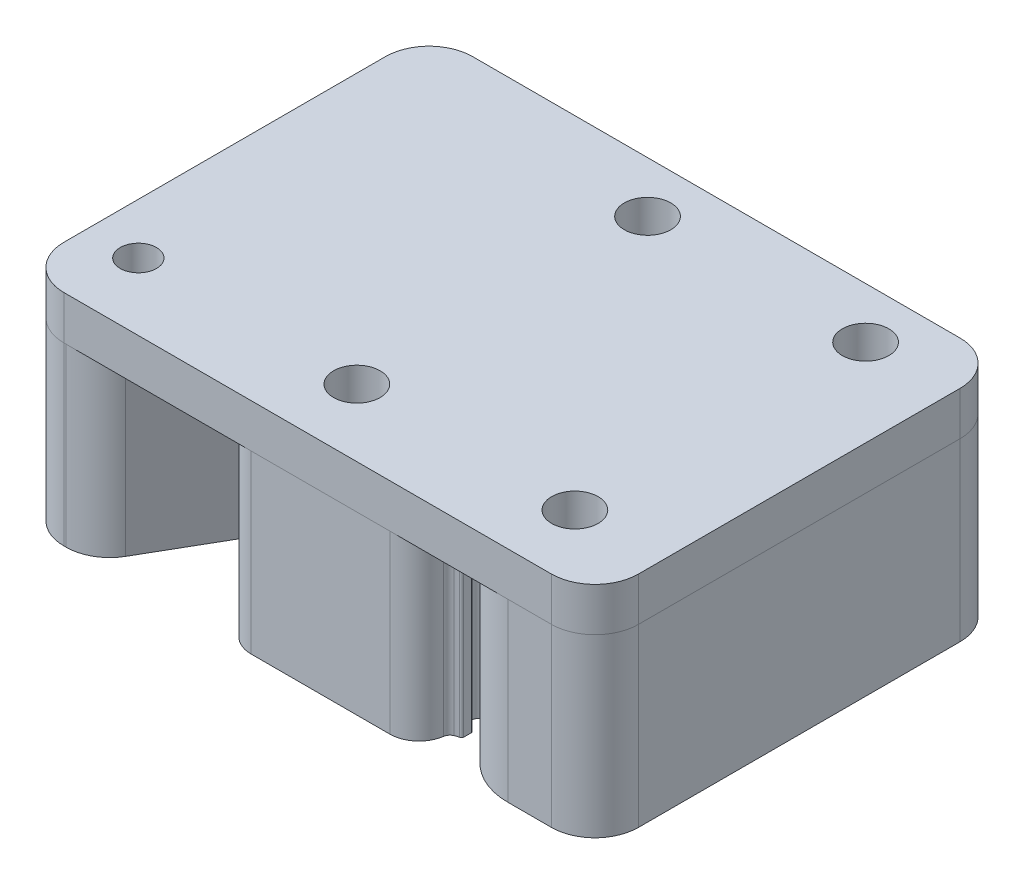
from build123d import *

# Parameters (mm, degrees)
BOSS_EXTRUDE1_DEPTH            = 6.05
M3_CLEARANCE_HOLE1_D           = 3.2
SKETCH6_W                      = 14.5
SKETCH6_H                      = 28.119
BOSS_EXTRUDE3_DEPTH            = 12.1
CUT_EXTRUDE2_DEPTH             = 12.1
SKETCH9_W                      = 3.425
SKETCH9_H                      = 12
CUT_EXTRUDE3_DEPTH             = 12.1
BOSS_EXTRUDE4_DEPTH            = 12.1
LPATTERN1_COUNT                = 9
LPATTERN1_PITCH                = 2
SKETCH12_R                     = 0.5
CUT_EXTRUDE5_DEPTH             = 12.1
CUT_EXTRUDE6_DEPTH             = 12.1
FILLET3_R                      = 0.5
CUT_EXTRUDE7_DEPTH             = 12.1
CUT_EXTRUDE8_DEPTH             = 12.1
M3_CLEARANCE_HOLE2_D           = 3.2
FILLET4_R                      = 3
CUT_EXTRUDE9_DEPTH             = 12.1
SKETCH22_R                     = 0.5
CUT_EXTRUDE10_DEPTH            = 12.1
FILLET5_R                      = 0.5
CBORE_FOR_M3_SHCS1_D           = 3.2
CBORE_FOR_M3_SHCS1_CBORE_D     = 6.5
CBORE_FOR_M3_SHCS1_CBORE_DEPTH = 6
BOSS_EXTRUDE8_DEPTH            = 12.1
FILLET6_R                      = 1
SKETCH31_W                     = 9.119
SKETCH31_H                     = 13.8
CUT_EXTRUDE11_DEPTH            = 12.1
CUT_EXTRUDE12_DEPTH            = 12.1
CUT_EXTRUDE14_DEPTH            = 12.1
CUT_EXTRUDE15_DEPTH            = 12.1
FILLET7_R                      = 2
FILLET8_R                      = 1
CUT_EXTRUDE16_START            = -12.1
CUT_EXTRUDE16_DEPTH            = 12.1
CUT_EXTRUDE17_DEPTH            = 12.1
FILLET9_R                      = 2
BOSS_EXTRUDE9_DEPTH            = 12.1
FILLET10_R                     = 2
SKETCH39_R                     = 1.6
BOSS_EXTRUDE10_DEPTH           = 6
BOSS_EXTRUDE11_DEPTH           = 12.1
SKETCH41_R                     = 1.6
SKETCH41_R_2                   = 1.25
BOSS_EXTRUDE12_DEPTH           = 3


with BuildPart() as part:
    # Sketch1 → Boss-Extrude1 (new, symmetric)
    with BuildSketch(Plane(origin=(0, 0, 0), x_dir=(1, 0, 0), z_dir=(0, 1, 0))):
        Polygon((-13.5, -13.5), (-13.5, -14.619), (13.5, -14.619), (13.5, -13.5), (13.5, 13.5), (-13.5, 13.5), align=None)
    extrude(amount=BOSS_EXTRUDE1_DEPTH, both=True)

    # M3 Clearance Hole1 (through all)
    with Locations(Plane(origin=(0, 6.05, 0), x_dir=(1, 0, 0), z_dir=(0, 1, 0))):
        with Locations((-7.5, 10), (7.5, 10), (7.5, -10), (-7.5, -10)):
            Hole(M3_CLEARANCE_HOLE1_D / 2)

    # Sketch6 → Boss-Extrude3 (add)
    with BuildSketch(Plane(origin=(0, 6.05, 0), x_dir=(1, 0, 0), z_dir=(0, 1, 0))):
        with Locations((-20.75, -0.5595)):
            Rectangle(SKETCH6_W, SKETCH6_H)
    extrude(amount=-BOSS_EXTRUDE3_DEPTH)

    # Sketch8 → Cut-Extrude2 (cut)
    with BuildSketch(Plane(origin=(0, 6.05, 0), x_dir=(1, 0, 0), z_dir=(0, 1, 0))):
        with BuildLine():
            Line((2.881, -10), (2.881, 4))
            Line((2.881, 4), (1.361, 4))
            Line((1.361, 4), (1.361, -14.619))
            Line((1.361, -14.619), (7.5, -14.619))
            ThreePointArc((7.5, -14.619), (4.233873778, -13.266126222), (2.881, -10))
        make_face()
    extrude(amount=-CUT_EXTRUDE2_DEPTH, mode=Mode.SUBTRACT)

    # Sketch9 → Cut-Extrude3 (cut)
    with BuildSketch(Plane(origin=(0, 6.05, 0), x_dir=(1, 0, 0), z_dir=(0, 1, 0))):
        with Locations((4.5935, -2)):
            Rectangle(SKETCH9_W, SKETCH9_H)
    extrude(amount=-CUT_EXTRUDE3_DEPTH, mode=Mode.SUBTRACT)

    # Sketch11 → Boss-Extrude4 (add)
    with BuildSketch(Plane(origin=(0, 6.05, 0), x_dir=(1, 0, 0), z_dir=(0, 1, 0))):
        with BuildLine():
            Line((1.361, 4), (1.361, 2.999999996))
            ThreePointArc((1.361, 2.999999996), (1.44536094, 3.29414941), (1.672797753, 3.498876404))
            ThreePointArc((1.672797753, 3.498876404), (1.822937846, 3.557611714), (1.980565217, 3.591456891))
            ThreePointArc((1.980565217, 3.591456891), (2.073771412, 3.641268354), (2.111, 3.740175425))
            Line((2.111, 3.740175425), (2.111, 4))
            Line((2.111, 4), (1.361, 4))
        make_face()
        with BuildLine():
            Line((2.111, 2), (2.111, 2.259824575))
            ThreePointArc((2.111, 2.259824575), (2.073771412, 2.358731646), (1.980565217, 2.408543109))
            ThreePointArc((1.980565217, 2.408543109), (1.822937846, 2.442388286), (1.672797753, 2.501123596))
            ThreePointArc((1.672797753, 2.501123596), (1.445360942, 2.705850587), (1.361, 2.999999996))
            Line((1.361, 2.999999996), (1.361, 2))
            Line((1.361, 2), (2.111, 2))
        make_face()
    boss_extrude4 = extrude(amount=-BOSS_EXTRUDE4_DEPTH)

    # LPattern1: Boss-Extrude4 ×9
    with Locations(*[(0, 0, i * LPATTERN1_PITCH) for i in range(1, LPATTERN1_COUNT)]):
        add(boss_extrude4)

    # Sketch12 → Cut-Extrude5 (cut)
    with BuildSketch(Plane(origin=(0, 6.05, 0), x_dir=(1, 0, 0), z_dir=(0, 1, 0))):
        with Locations((2.111, 4)):
            Circle(SKETCH12_R)
        with Locations((6.306, 4)):
            Circle(SKETCH12_R)
        with Locations((6.306, -8)):
            Circle(SKETCH12_R)
    extrude(amount=-CUT_EXTRUDE5_DEPTH, mode=Mode.SUBTRACT)

    # Sketch13 → Cut-Extrude6 (cut)
    with BuildSketch(Plane(origin=(0, 6.05, 0), x_dir=(1, 0, 0), z_dir=(0, 1, 0))):
        with BuildLine():
            Line((2.111, -14), (1.361, -14))
            Line((1.361, -14), (1.361, -13))
            ThreePointArc((1.361, -13), (1.445360941, -13.294149412), (1.672797753, -13.498876404))
            ThreePointArc((1.672797753, -13.498876404), (1.822937846, -13.557611714), (1.980565217, -13.591456891))
            ThreePointArc((1.980565217, -13.591456891), (2.073771412, -13.641268354), (2.111, -13.740175425))
            Line((2.111, -13.740175425), (2.111, -14))
        make_face()
    extrude(amount=-CUT_EXTRUDE6_DEPTH, mode=Mode.SUBTRACT)

    # Fillet3
    fillet3_edges = [part.edges().sort_by_distance(p)[0] for p in [
        (5.806, 0, 8),
        (6.306, 0, 7.5),
        (5.806, 0, -4),
        (6.306, 0, -3.5),
        (2.611, 0, -4),
        (1.859499402, 0, -3.567857143),
        (2.881, 0, 8),
    ]]
    fillet(fillet3_edges, radius=FILLET3_R)

    # Sketch17 → Cut-Extrude7 (cut)
    with BuildSketch(Plane(origin=(0, 6.05, 0), x_dir=(1, 0, 0), z_dir=(0, 1, 0))):
        Polygon((-21.159530019, -14.619), (-15.513044386, -17.879), (-2.937822174, 3.901923789), (-8.584307806, 7.161923789), align=None)
    extrude(amount=-CUT_EXTRUDE7_DEPTH, mode=Mode.SUBTRACT)

    # Sketch18 → Cut-Extrude8 (cut)
    with BuildSketch(Plane(origin=(0, 6.05, 0), x_dir=(1, 0, 0), z_dir=(0, 1, 0))):
        with BuildLine():
            Line((-28, -14.619), (-26.03420101, -14.619))
            Line((-26.03420101, -14.619), (-26.03420101, -10.212177826))
            Line((-26.03420101, -10.212177826), (-26.03420101, -10))
            ThreePointArc((-26.03420101, -10), (-25.513488055, -8.163196063), (-24.106287465, -6.872933615))
            Line((-24.106287465, -6.872933615), (-14.148521025, 10.374423789))
            Line((-14.148521025, 10.374423789), (-12.343968759, 13.5))
            Line((-12.343968759, 13.5), (-28, 13.5))
            Line((-28, 13.5), (-28, -14.619))
        make_face()
    extrude(amount=-CUT_EXTRUDE8_DEPTH, mode=Mode.SUBTRACT)

    # M3 Clearance Hole2 (through all)
    with Locations(Plane(origin=(0, 6.05, 0), x_dir=(1, 0, 0), z_dir=(0, 1, 0))):
        with Locations((-22.53420101, -10)):
            Hole(M3_CLEARANCE_HOLE2_D / 2)

    # Fillet4
    fillet4_edges = [part.edges().sort_by_distance(p)[0] for p in [
        (13.5, 0, -13.5),
        (13.5, 0, 14.619),
        (-21.159530019, 0, 14.619),
        (-12.343968759, 0, -13.5),
        (-26.03420101, 0, 14.619),
    ]]
    fillet(fillet4_edges, radius=FILLET4_R)

    # Sketch21 → Cut-Extrude9 (cut)
    with BuildSketch(Plane(origin=(0, 6.05, 0), x_dir=(1, 0, 0), z_dir=(0, 1, 0))):
        Polygon((-17.834307806, -8.859546181), (-20.800444814, -7.147046181), (-12.300444814, 7.575385683), (-9.334307806, 5.862885683), align=None)
    extrude(amount=-CUT_EXTRUDE9_DEPTH, mode=Mode.SUBTRACT)

    # Sketch22 → Cut-Extrude10 (cut)
    with BuildSketch(Plane(origin=(0, 6.05, 0), x_dir=(1, 0, 0), z_dir=(0, 1, 0))):
        with Locations((-20.800444814, -7.147046181)):
            Circle(SKETCH22_R)
        with Locations((-12.300444814, 7.575385683)):
            Circle(SKETCH22_R)
        with Locations((-8.584307806, 7.161923789)):
            Circle(SKETCH22_R)
        with Locations((-2.937822174, 3.901923789)):
            Circle(SKETCH22_R)
    extrude(amount=-CUT_EXTRUDE10_DEPTH, mode=Mode.SUBTRACT)

    # Fillet5
    fillet5_edges = [part.edges().sort_by_distance(p)[0] for p in [
        (-9.334307806, 0, -5.862885683),
        (-17.834307806, 0, 8.859546181),
        (-11.867432112, 0, -7.325385683),
        (-20.550444814, 0, 6.714033479),
        (-3.370834875, 0, -4.151923789),
        (-8.151295104, 0, -6.911923789),
        (-20.367432112, 0, 7.397046181),
        (-12.550444814, 0, -7.142372981),
        (-8.834307806, 0, -6.728911087),
        (-3.187822174, 0, -3.468911087),
    ]]
    fillet(fillet5_edges, radius=FILLET5_R)

    # CBORE for M3 SHCS1 (through all)
    with Locations(Plane(origin=(6.955127019, 0, -12.04663337), x_dir=(-0.8660254037844397, 0, -0.4999999999999981), z_dir=(0.4999999999999981, 0, -0.8660254037844397))):
        with Locations((6.995190528, 0)):
            CounterBoreHole(CBORE_FOR_M3_SHCS1_D / 2, CBORE_FOR_M3_SHCS1_CBORE_D / 2, CBORE_FOR_M3_SHCS1_CBORE_DEPTH)

    # Sketch30 → Boss-Extrude8 (add)
    with BuildSketch(Plane(origin=(0, 6.05, 0), x_dir=(1, 0, 0), z_dir=(0, 1, 0))):
        with BuildLine():
            Line((3.381, -8), (5.439974596, -8))
            ThreePointArc((5.439974596, -8), (5.689974596, -8.066987298), (5.872987298, -8.25))
            ThreePointArc((5.872987298, -8.25), (6.659553391, -8.353553391), (6.556, -7.566987298))
            ThreePointArc((6.556, -7.566987298), (6.372987298, -7.383974596), (6.306, -7.133974596))
            Line((6.306, -7.133974596), (6.306, 3.133974596))
            ThreePointArc((6.306, 3.133974596), (6.372987298, 3.383974596), (6.556, 3.566987298))
            ThreePointArc((6.556, 3.566987298), (6.659553391, 4.353553391), (5.872987298, 4.25))
            ThreePointArc((5.872987298, 4.25), (5.689974596, 4.066987298), (5.439974596, 4))
            Line((5.439974596, 4), (2.977025404, 4))
            ThreePointArc((2.977025404, 4), (2.928787691, 4.002332317), (2.881, 4.009307508))
            Line((2.881, 4.009307508), (2.881, -8.5))
            ThreePointArc((2.881, -8.5), (3.027446609, -8.146446609), (3.381, -8))
        make_face()
        with BuildLine():
            Line((-18.084307806, -9.292558883), (-9.084307806, 6.295898385))
            ThreePointArc((-9.084307806, 6.295898385), (-9.387910986, 6.062935472), (-9.767320508, 6.112885683))
            Line((-9.767320508, 6.112885683), (-11.550444814, 7.142372981))
            ThreePointArc((-11.550444814, 7.142372981), (-11.733457516, 7.325385683), (-11.800444814, 7.575385683))
            ThreePointArc((-11.800444814, 7.575385683), (-12.429854337, 8.058348596), (-12.733457516, 7.325385683))
            ThreePointArc((-12.733457516, 7.325385683), (-12.666470218, 7.075385683), (-12.733457516, 6.825385683))
            Line((-12.733457516, 6.825385683), (-20.367432112, -6.397046181))
            ThreePointArc((-20.367432112, -6.397046181), (-20.550444814, -6.580058883), (-20.800444814, -6.647046181))
            ThreePointArc((-20.800444814, -6.647046181), (-21.283407727, -7.276455704), (-20.550444814, -7.580058883))
            ThreePointArc((-20.550444814, -7.580058883), (-20.300444814, -7.513071585), (-20.050444814, -7.580058883))
            Line((-20.050444814, -7.580058883), (-18.267320508, -8.609546181))
            ThreePointArc((-18.267320508, -8.609546181), (-18.034357595, -8.913149361), (-18.084307806, -9.292558883))
        make_face()
    extrude(amount=-BOSS_EXTRUDE8_DEPTH)

    # Fillet6
    fillet6_edges = [part.edges().sort_by_distance(p)[0] for p in [
        (2.881, 0, -4.009307508),
    ]]
    fillet(fillet6_edges, radius=FILLET6_R)

    # Sketch31 → Cut-Extrude11 (cut)
    with BuildSketch(Plane(origin=(0, 6.05, 0), x_dir=(1, 0, 0), z_dir=(0, 1, 0))):
        with Locations((8.9405, 0)):
            Rectangle(SKETCH31_W, SKETCH31_H)
    extrude(amount=-CUT_EXTRUDE11_DEPTH, mode=Mode.SUBTRACT)

    # Sketch32 → Cut-Extrude12 (cut)
    with BuildSketch(Plane(origin=(0, 6.05, 0), x_dir=(1, 0, 0), z_dir=(0, 1, 0))):
        with BuildLine():
            Line((-10.057382948, 7.610482799), (-19.36600954, -8.512531407))
            ThreePointArc((-19.36600954, -8.512531407), (-21.390103971, -6.69227541), (-24.106287465, -6.872933615))
            Line((-24.106287465, -6.872933615), (-13.209994162, 12))
            ThreePointArc((-13.209994162, 12), (-12.111917951, 13.098076211), (-10.611917951, 13.5))
            Line((-10.611917951, 13.5), (-7.5, 13.5))
            ThreePointArc((-7.5, 13.5), (-10.710397966, 11.394039059), (-10.057382948, 7.610482799))
        make_face()
    extrude(amount=-CUT_EXTRUDE12_DEPTH, mode=Mode.SUBTRACT)

    # Sketch34 → Cut-Extrude14 (cut)
    with BuildSketch(Plane.XZ.offset(6.05)):
        with BuildLine():
            Line((0.111, -6.182638696), (-7.442572109, 6.900531975))
            ThreePointArc((-7.442572109, 6.900531975), (-4.514806986, 9.164163493), (-5.841434656, 12.619))
            Line((-5.841434656, 12.619), (0.111, 12.619))
            Line((0.111, 12.619), (0.111, -6.182638696))
        make_face()
    extrude(amount=-CUT_EXTRUDE14_DEPTH, mode=Mode.SUBTRACT)

    # Sketch35 → Cut-Extrude15 (cut)
    with BuildSketch(Plane.XZ.offset(6.05)):
        with BuildLine():
            Line((-7.562177826, -13.5), (1.271281292, -8.4))
            Line((1.271281292, -8.4), (4.387123517, -8.4))
            ThreePointArc((4.387123517, -8.4), (4.512526151, -11.823458253), (7.5, -13.5))
            Line((7.5, -13.5), (-7.562177826, -13.5))
        make_face()
    extrude(amount=-CUT_EXTRUDE15_DEPTH, mode=Mode.SUBTRACT)

    # Fillet7
    # the kernel refuses this fillet: 2 mm, written as the material it adds along each edge
    with BuildSketch(Plane(origin=(4.381, 6.05, 6.9), x_dir=(0, 0, -1), z_dir=(0, -1, 0)), Plane(origin=(4.381, 6.05, -6.9), x_dir=(1, 0, 0), z_dir=(0, -1, 0))) as fillet7_piece_1:
        with BuildLine():
            CenterArc((FILLET7_R, FILLET7_R), FILLET7_R, 180, 90)
            Line((0, FILLET7_R), (0, 0))
            Line((0, 0), (FILLET7_R, 0))
        make_face()
    extrude(amount=12.1)
    with BuildSketch(Plane(origin=(-19.36600954, 6.05, 8.512531407), x_dir=(-0.676555335511721, 0, -0.7363917965258864), z_dir=(0, -1, 0))) as fillet7_piece_2:
        with BuildLine():
            CenterArc((2.695107017, 1.908220012), FILLET7_R, 162.57504771, 90)
            Line((0.786887005, 2.507132682), (0, 0))
            ThreePointArc((0, 0), (1.048097173, 0.160614979), (2.096194346, 0))
        make_face()
    extrude(amount=12.1)
    with BuildSketch(Plane(origin=(-10.057382948, 6.05, -7.610482799), x_dir=(-0.49999999999999944, 0, 0.866025403784439), z_dir=(0, -1, 0))) as fillet7_piece_3:
        with BuildLine():
            CenterArc((1.248620391, 2), FILLET7_R, 213.304667866, 56.695332134)
            ThreePointArc((-0.422904869, 0.901818182), (-0.179207665, 0.466030177), (0, 0))
            Line((0, 0), (1.248620391, 0))
        make_face()
    extrude(amount=12.1)
    # the kernel refuses this fillet: 2 mm, written as the material it takes off along each edge
    with BuildSketch(Plane(origin=(-13.630882509, -14.710254038, 14.619), x_dir=(1, 0, 0), z_dir=(0, 1, 0))) as fillet7_2_piece_1:
        with BuildLine():
            CenterArc((FILLET7_R * 1.73205080757, FILLET7_R), FILLET7_R, 150, 120)
            Line((FILLET7_R * 0.866025403784, FILLET7_R * 1.5), (0, 0))
            Line((0, 0), (FILLET7_R * 1.73205080757, 0))
        make_face()
    extrude(amount=29.420508076, mode=Mode.SUBTRACT)
    with BuildSketch(Plane(origin=(1.361, 10.978582647, 14.619), x_dir=(0.0036463999603744903, 0, -0.9999933518615657), z_dir=(0, -1, 0))) as fillet7_2_piece_2:
        with BuildLine():
            CenterArc((1.99279807, -1.978712752), FILLET7_R, 98.366972649, 81.42410356)
            Line((-0.007188633, -1.971419952), (-0.207187304, -1.970690672))
            Line((-0.207187304, -1.970690672), (-0.19999867, 0.00072928))
            Line((-0.19999867, 0.00072928), (0.00072928, 0.19999867))
            ThreePointArc((0.00072928, 0.19999867), (1.619718517, 0.194095149), (1.672670016, 0.197871275))
            Line((1.672670016, 0.197871275), (1.701772566, 0))
        make_face()
    extrude(amount=21.957165293, mode=Mode.SUBTRACT)
    with BuildSketch(Plane(origin=(13.5, 11.05, -6.9), x_dir=(0, 0, -1), z_dir=(0, -1, 0)), Plane(origin=(13.5, 11.05, 6.9), x_dir=(-1, 0, 0), z_dir=(0, -1, 0))) as fillet7_2_piece_3:
        with BuildLine():
            CenterArc((FILLET7_R, -FILLET7_R), FILLET7_R, 90, 90)
            Line((0, -FILLET7_R), (0, 0))
            Line((0, 0), (FILLET7_R, 0))
        make_face()
    extrude(amount=22.1, mode=Mode.SUBTRACT)
    with BuildSketch(Plane(origin=(-7.5612495, -8.664900365, -13.49946403), x_dir=(-0.9860070892586756, 0, 0.1667033890826284), z_dir=(0, 1, 0))) as fillet7_2_piece_4:
        with BuildLine():
            CenterArc((0.74711439, 1.977546767), FILLET7_R, 230.403797881, 48.189685104)
            Line((-0.527631439, 0.43643578), (0, 0))
            ThreePointArc((0, 0), (0.522980073, -0.039293158), (1.045960146, 0))
        make_face()
    extrude(amount=17.32980073, mode=Mode.SUBTRACT)

    # Fillet8
    fillet8_edges = [part.edges().sort_by_distance(p)[0] for p in [
        (-5.841434656, 0, 12.619),
        (-7.442572109, 0, 6.900531975),
        (0.111, 0, -6.182638696),
        (0.111, 0, 12.619),
        (4.387123517, 0, -8.4),
        (1.271281292, 0, -8.4),
    ]]
    fillet(fillet8_edges, radius=FILLET8_R)

    # Sketch36 → Cut-Extrude16 (cut)
    with BuildSketch(Plane(origin=(0, 6.05, 0), x_dir=(1, 0, 0), z_dir=(0, 1, 0)).offset(CUT_EXTRUDE16_START)):
        with BuildLine():
            Line((2.881, 4.475925631), (2.881, 3.475925631))
            ThreePointArc((2.881, 3.475925631), (2.811237497, 3.842883665), (2.611683603, 4.158641877))
            ThreePointArc((2.611683603, 4.158641877), (2.575243056, 4.202391289), (2.544012702, 4.25))
            ThreePointArc((2.544012702, 4.25), (1.981590477, 4.482962913), (1.611, 4))
            Line((1.611, 4), (1.611, 4.475925631))
            ThreePointArc((1.611, 4.475925631), (2.246, 5.110925631), (2.881, 4.475925631))
        make_face()
    extrude(amount=CUT_EXTRUDE16_DEPTH, mode=Mode.SUBTRACT)

    # Sketch37 → Cut-Extrude17 (cut)
    with BuildSketch(Plane(origin=(0, 6.05, 0), x_dir=(1, 0, 0), z_dir=(0, 1, 0))):
        with BuildLine():
            Line((-10.681693144, 6.52914582), (-9.847039869, 7.9748077))
            ThreePointArc((-9.847039869, 7.9748077), (-10.120058716, 11.656892369), (-6.676387463, 12.988588695))
            Line((-6.676387463, 12.988588695), (-6.968245837, 13.157093206))
            ThreePointArc((-6.968245837, 13.157093206), (-7.762481689, 13.414429519), (-8.592573619, 13.325098929))
            ThreePointArc((-8.592573619, 13.325098929), (-10.732232772, 11.342635956), (-10.626927969, 8.427638249))
            ThreePointArc((-10.626927969, 8.427638249), (-10.414575563, 7.47147648), (-10.681693144, 6.52914582))
        make_face()
    extrude(amount=-CUT_EXTRUDE17_DEPTH, mode=Mode.SUBTRACT)

    # Fillet9
    fillet9_edges = [part.edges().sort_by_distance(p)[0] for p in [
        (-6.676387463, 0, -12.988588695),
        (-9.847039869, 0, -7.9748077),
    ]]
    fillet(fillet9_edges, radius=FILLET9_R)

    # Sketch38 → Boss-Extrude9 (add)
    with BuildSketch(Plane(origin=(0, 6.05, 0), x_dir=(1, 0, 0), z_dir=(0, 1, 0))):
        with BuildLine():
            Line((-26.03420101, -10), (-26.03420101, 13.1))
            Line((-26.03420101, 13.1), (-7.5, 13.1))
            ThreePointArc((-7.5, 13.1), (-9.024795068, 12.699073915), (-10.155183609, 11.6))
            Line((-10.155183609, 11.6), (-24.53420101, 11.6))
            Line((-24.53420101, 11.6), (-24.53420101, -7.127718677))
            ThreePointArc((-24.53420101, -7.127718677), (-25.636619421, -8.379814825), (-26.03420101, -10))
        make_face()
    extrude(amount=-BOSS_EXTRUDE9_DEPTH)

    # Fillet10
    fillet10_edges = [part.edges().sort_by_distance(p)[0] for p in [
        (-24.53420101, 0, 7.127718677),
        (-26.03420101, 0, -13.1),
        (-10.155183609, 0, -11.6),
        (-24.53420101, 0, -11.6),
    ]]
    fillet(fillet10_edges, radius=FILLET10_R)

    # Sketch39 → Boss-Extrude10 (add)
    with BuildSketch(Plane(origin=(0.955127019, 0, -1.654328524), x_dir=(0.8660254037844397, 0, 0.4999999999999981), z_dir=(-0.4999999999999981, 0, 0.8660254037844397))):
        with Locations((-6.995190528, 0)):
            Circle(SKETCH39_R)
    extrude(amount=-BOSS_EXTRUDE10_DEPTH)

    # Sketch40 → Boss-Extrude11 (add)
    with BuildSketch(Plane(origin=(0, 6.05, 0), x_dir=(1, 0, 0), z_dir=(0, 1, 0))):
        with BuildLine():
            Line((-22.53420101, 11.6), (-12.584289528, 11.6))
            ThreePointArc((-12.584289528, 11.6), (-11.226667616, 11.068626142), (-10.590450497, 9.756862745))
            ThreePointArc((-10.590450497, 9.756862745), (-10.506681057, 9.245103304), (-10.338776157, 8.754468013))
            ThreePointArc((-10.338776157, 8.754468013), (-10.173276256, 7.840820604), (-10.438193838, 6.95089899))
            Line((-10.438193838, 6.95089899), (-18.052150202, -6.236860279))
            ThreePointArc((-18.052150202, -6.236860279), (-19.266562919, -7.168711932), (-20.78420101, -6.968911087))
            ThreePointArc((-20.78420101, -6.968911087), (-21.628334352, -6.619259608), (-22.53420101, -6.5))
            ThreePointArc((-22.53420101, -6.5), (-23.948414572, -5.914213562), (-24.53420101, -4.5))
            Line((-24.53420101, -4.5), (-24.53420101, 9.6))
            ThreePointArc((-24.53420101, 9.6), (-23.948414572, 11.014213562), (-22.53420101, 11.6))
        make_face()
        with BuildLine():
            Line((0.111, 2.450587889), (0.111, -11.619))
            ThreePointArc((0.111, -11.619), (-0.181893219, -12.326106781), (-0.889, -12.619))
            Line((-0.889, -12.619), (-3.733192466, -12.619))
            ThreePointArc((-3.733192466, -12.619), (-4.568320614, -12.16905543), (-4.651926011, -11.224121951))
            ThreePointArc((-4.651926011, -11.224121951), (-4.623166664, -8.845084438), (-6.2889689, -7.146335045))
            ThreePointArc((-6.2889689, -7.146335045), (-6.846624274, -6.543141733), (-6.764339111, -5.725797963))
            Line((-6.764339111, -5.725797963), (-1.755025404, 2.950587889))
            ThreePointArc((-1.755025404, 2.950587889), (-0.630180955, 3.416513715), (0.111, 2.450587889))
        make_face()
        with BuildLine():
            Line((6.381, -6.9), (11.5, -6.9))
            ThreePointArc((11.5, -6.9), (12.914213562, -7.485786438), (13.5, -8.9))
            Line((13.5, -8.9), (13.5, 8.9))
            ThreePointArc((13.5, 8.9), (12.914213562, 7.485786438), (11.5, 6.9))
            Line((11.5, 6.9), (6.381, 6.9))
            ThreePointArc((6.381, 6.9), (4.966786438, 6.314213562), (4.381, 4.9))
            Line((4.381, 4.9), (4.381, -4.9))
            ThreePointArc((4.381, -4.9), (4.966786438, -6.314213562), (6.381, -6.9))
        make_face()
    extrude(amount=-BOSS_EXTRUDE11_DEPTH)


with BuildPart() as body_2:
    # Sketch41 → Boss-Extrude12 (new body)
    with BuildSketch(Plane(origin=(0, 6.05, 0), x_dir=(1, 0, 0), z_dir=(0, 1, 0))):
        with BuildLine():
            Line((10.5, 13.5), (-23.03420101, 13.5))
            ThreePointArc((-23.03420101, 13.5), (-25.155521353, 12.621320344), (-26.03420101, 10.5))
            Line((-26.03420101, 10.5), (-26.03420101, -11.619))
            ThreePointArc((-26.03420101, -11.619), (-25.155521353, -13.740320344), (-23.03420101, -14.619))
            Line((-23.03420101, -14.619), (-22.891580826, -14.619))
            Line((-22.891580826, -14.619), (10.5, -14.619))
            ThreePointArc((10.5, -14.619), (12.621320344, -13.740320344), (13.5, -11.619))
            Line((13.5, -11.619), (13.5, 10.5))
            ThreePointArc((13.5, 10.5), (12.621320344, 12.621320344), (10.5, 13.5))
        make_face()
        with Locations(Location((7.5, 10, 0), (0, 0, 270))):
            Circle(SKETCH41_R, mode=Mode.SUBTRACT)
        with Locations(Location((-7.5, 10, 0), (0, 0, 270))):
            Circle(SKETCH41_R, mode=Mode.SUBTRACT)
        with Locations(Location((7.5, -10, 0), (0, 0, 270))):
            Circle(SKETCH41_R, mode=Mode.SUBTRACT)
        with Locations(Location((-7.5, -10, 0), (0, 0, 270))):
            Circle(SKETCH41_R, mode=Mode.SUBTRACT)
        with Locations(Location((-22.53420101, -10, 0), (0, 0, 270))):
            Circle(SKETCH41_R_2, mode=Mode.SUBTRACT)
    extrude(amount=BOSS_EXTRUDE12_DEPTH)


solid = Compound([part.part, body_2.part])
